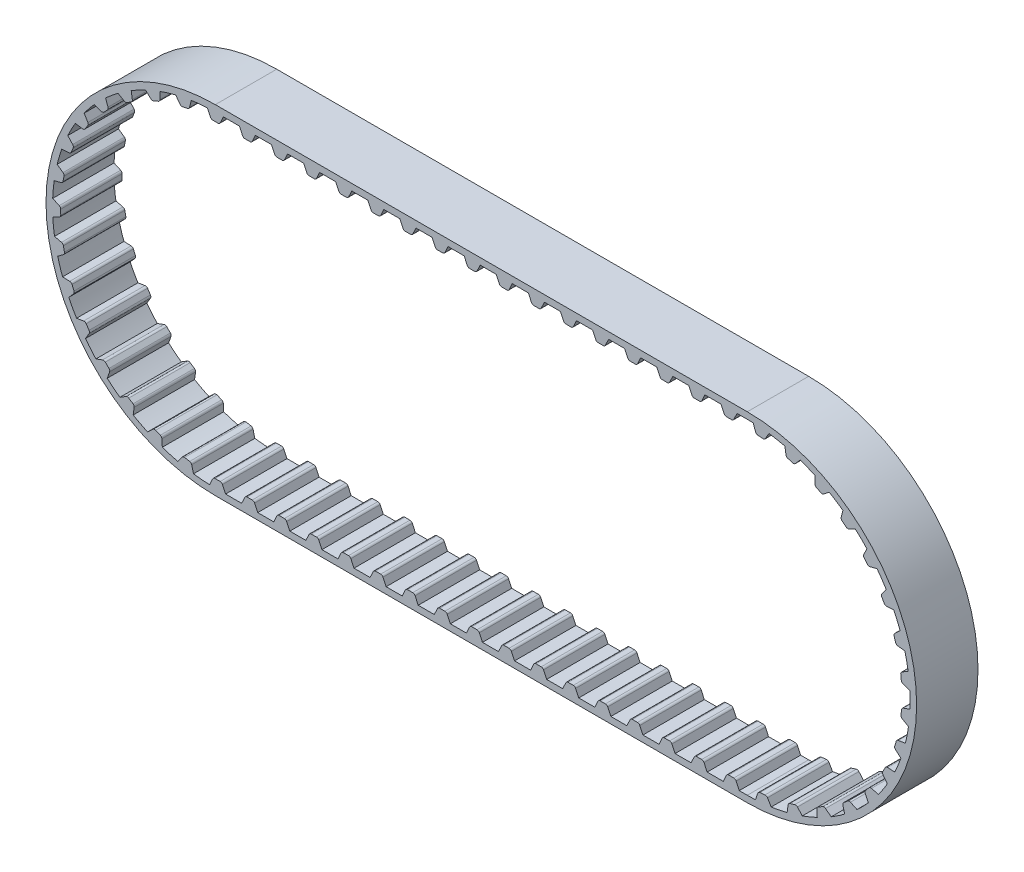
from build123d import *

# Parameters (mm, degrees)
BOSS_EXTRUDE1_DEPTH      = 4.7625
BOSS_EXTRUDE1_DEPTH_BACK = 4.7625
BOSS_EXTRUDE2_DEPTH      = 4.7625
FILLET1_R                = 0.396875
CRVPATTERN1_START        = -4.7625
CRVPATTERN1_DEPTH        = 9.525


# Read off the part's stored shape, not the designer's step: CrvPattern1
with BuildPart() as part:
    # Sketch4 → Boss-Extrude1 (new, two sides: drawn at the far end of the back side and taken through both)
    with BuildSketch(Plane.XY.offset(-BOSS_EXTRUDE1_DEPTH_BACK)):
        with BuildLine():
            Line((-41.275, -26.276481104), (41.275, -26.276481104))
            ThreePointArc((41.275, -26.276481104), (67.551481104, 0), (41.275, 26.276481104))
            Line((41.275, 26.276481104), (-41.275, 26.276481104))
            ThreePointArc((-41.275, 26.276481104), (-67.551481104, 0), (-41.275, -26.276481104))
        make_face()
        with BuildLine():
            Line((-41.275, -25.260481104), (41.275, -25.260481104))
            ThreePointArc((41.275, -25.260481104), (66.535481104, 0), (41.275, 25.260481104))
            Line((41.275, 25.260481104), (-41.275, 25.260481104))
            ThreePointArc((-41.275, 25.260481104), (-66.535481104, 0), (-41.275, -25.260481104))
        make_face(mode=Mode.SUBTRACT)
    extrude(amount=BOSS_EXTRUDE1_DEPTH + BOSS_EXTRUDE1_DEPTH_BACK)

    # Sketch5 → Boss-Extrude2 (add, symmetric)
    with BuildSketch(Plane.XY):
        Polygon((-42.5196, 25.260481104), (-41.927389274, 23.990481104), (-40.622610726, 23.990481104), (-40.0304, 25.260481104), align=None)
    extrude(amount=BOSS_EXTRUDE2_DEPTH, both=True)

    # Fillet1
    fillet1_edges = [part.edges().sort_by_distance(p)[0] for p in [
        (-41.927389274, 23.990481104, 0),
        (-40.622610726, 23.990481104, 0),
    ]]
    fillet(fillet1_edges, radius=FILLET1_R)

    # CrvPattern1 outline → CrvPattern1 (add)
    with BuildSketch(Plane.XY.offset(CRVPATTERN1_START)):
        with BuildLine():
            Line((-35.533968102, 24.219629482), (-35.04861102, 25.260481104))
            Line((-35.04861102, 25.260481104), (-37.53781102, 25.260481104))
            Line((-37.53781102, 25.260481104), (-37.052453937, 24.219629482))
            ThreePointArc((-37.052453937, 24.219629482), (-36.906003816, 24.052635124), (-36.692763034, 23.990481104))
            Line((-36.692763034, 23.990481104), (-35.893659005, 23.990481104))
            ThreePointArc((-35.893659005, 23.990481104), (-35.680418223, 24.052635124), (-35.533968102, 24.219629482))
        make_face()
        with BuildLine():
            Line((-30.552179122, 24.219629482), (-30.066822039, 25.260481104))
            Line((-30.066822039, 25.260481104), (-32.556022039, 25.260481104))
            Line((-32.556022039, 25.260481104), (-32.070664957, 24.219629482))
            ThreePointArc((-32.070664957, 24.219629482), (-31.924214836, 24.052635124), (-31.710974054, 23.990481104))
            Line((-31.710974054, 23.990481104), (-30.911870025, 23.990481104))
            ThreePointArc((-30.911870025, 23.990481104), (-30.698629243, 24.052635124), (-30.552179122, 24.219629482))
        make_face()
        with BuildLine():
            Line((-25.570390141, 24.219629482), (-25.085033059, 25.260481104))
            Line((-25.085033059, 25.260481104), (-27.574233059, 25.260481104))
            Line((-27.574233059, 25.260481104), (-27.088875976, 24.219629482))
            ThreePointArc((-27.088875976, 24.219629482), (-26.942425855, 24.052635124), (-26.729185073, 23.990481104))
            Line((-26.729185073, 23.990481104), (-25.930081044, 23.990481104))
            ThreePointArc((-25.930081044, 23.990481104), (-25.716840262, 24.052635124), (-25.570390141, 24.219629482))
        make_face()
        with BuildLine():
            Line((-20.588601161, 24.219629482), (-20.103244078, 25.260481104))
            Line((-20.103244078, 25.260481104), (-22.592444078, 25.260481104))
            Line((-22.592444078, 25.260481104), (-22.107086996, 24.219629482))
            ThreePointArc((-22.107086996, 24.219629482), (-21.960636875, 24.052635124), (-21.747396093, 23.990481104))
            Line((-21.747396093, 23.990481104), (-20.948292064, 23.990481104))
            ThreePointArc((-20.948292064, 23.990481104), (-20.735051282, 24.052635124), (-20.588601161, 24.219629482))
        make_face()
        with BuildLine():
            Line((-15.60681218, 24.219629482), (-15.121455098, 25.260481104))
            Line((-15.121455098, 25.260481104), (-17.610655098, 25.260481104))
            Line((-17.610655098, 25.260481104), (-17.125298015, 24.219629482))
            ThreePointArc((-17.125298015, 24.219629482), (-16.978847894, 24.052635124), (-16.765607112, 23.990481104))
            Line((-16.765607112, 23.990481104), (-15.966503083, 23.990481104))
            ThreePointArc((-15.966503083, 23.990481104), (-15.753262301, 24.052635124), (-15.60681218, 24.219629482))
        make_face()
        with BuildLine():
            Line((-10.6250232, 24.219629482), (-10.139666117, 25.260481104))
            Line((-10.139666117, 25.260481104), (-12.628866117, 25.260481104))
            Line((-12.628866117, 25.260481104), (-12.143509035, 24.219629482))
            ThreePointArc((-12.143509035, 24.219629482), (-11.997058914, 24.052635124), (-11.783818132, 23.990481104))
            Line((-11.783818132, 23.990481104), (-10.984714103, 23.990481104))
            ThreePointArc((-10.984714103, 23.990481104), (-10.771473321, 24.052635124), (-10.6250232, 24.219629482))
        make_face()
        with BuildLine():
            Line((-5.64323422, 24.219629482), (-5.157877137, 25.260481104))
            Line((-5.157877137, 25.260481104), (-7.647077137, 25.260481104))
            Line((-7.647077137, 25.260481104), (-7.161720054, 24.219629482))
            ThreePointArc((-7.161720054, 24.219629482), (-7.015269933, 24.052635124), (-6.802029151, 23.990481104))
            Line((-6.802029151, 23.990481104), (-6.002925123, 23.990481104))
            ThreePointArc((-6.002925123, 23.990481104), (-5.789684341, 24.052635124), (-5.64323422, 24.219629482))
        make_face()
        with BuildLine():
            Line((-0.661445239, 24.219629482), (-0.176088157, 25.260481104))
            Line((-0.176088157, 25.260481104), (-2.665288157, 25.260481104))
            Line((-2.665288157, 25.260481104), (-2.179931074, 24.219629482))
            ThreePointArc((-2.179931074, 24.219629482), (-2.033480953, 24.052635124), (-1.820240171, 23.990481104))
            Line((-1.820240171, 23.990481104), (-1.021136142, 23.990481104))
            ThreePointArc((-1.021136142, 23.990481104), (-0.80789536, 24.052635124), (-0.661445239, 24.219629482))
        make_face()
        with BuildLine():
            Line((4.320343741, 24.219629482), (4.805700824, 25.260481104))
            Line((4.805700824, 25.260481104), (2.316500824, 25.260481104))
            Line((2.316500824, 25.260481104), (2.801857906, 24.219629482))
            ThreePointArc((2.801857906, 24.219629482), (2.948308027, 24.052635124), (3.161548809, 23.990481104))
            Line((3.161548809, 23.990481104), (3.960652838, 23.990481104))
            ThreePointArc((3.960652838, 23.990481104), (4.17389362, 24.052635124), (4.320343741, 24.219629482))
        make_face()
        with BuildLine():
            Line((9.302132722, 24.219629482), (9.787489804, 25.260481104))
            Line((9.787489804, 25.260481104), (7.298289804, 25.260481104))
            Line((7.298289804, 25.260481104), (7.783646887, 24.219629482))
            ThreePointArc((7.783646887, 24.219629482), (7.930097008, 24.052635124), (8.14333779, 23.990481104))
            Line((8.14333779, 23.990481104), (8.942441819, 23.990481104))
            ThreePointArc((8.942441819, 23.990481104), (9.155682601, 24.052635124), (9.302132722, 24.219629482))
        make_face()
        with BuildLine():
            Line((14.283921702, 24.219629482), (14.769278785, 25.260481104))
            Line((14.769278785, 25.260481104), (12.280078785, 25.260481104))
            Line((12.280078785, 25.260481104), (12.765435867, 24.219629482))
            ThreePointArc((12.765435867, 24.219629482), (12.911885988, 24.052635124), (13.12512677, 23.990481104))
            Line((13.12512677, 23.990481104), (13.924230799, 23.990481104))
            ThreePointArc((13.924230799, 23.990481104), (14.137471581, 24.052635124), (14.283921702, 24.219629482))
        make_face()
        with BuildLine():
            Line((19.265710683, 24.219629482), (19.751067765, 25.260481104))
            Line((19.751067765, 25.260481104), (17.261867765, 25.260481104))
            Line((17.261867765, 25.260481104), (17.747224848, 24.219629482))
            ThreePointArc((17.747224848, 24.219629482), (17.893674969, 24.052635124), (18.106915751, 23.990481104))
            Line((18.106915751, 23.990481104), (18.90601978, 23.990481104))
            ThreePointArc((18.90601978, 23.990481104), (19.119260562, 24.052635124), (19.265710683, 24.219629482))
        make_face()
        with BuildLine():
            Line((24.247499663, 24.219629482), (24.732856746, 25.260481104))
            Line((24.732856746, 25.260481104), (22.243656746, 25.260481104))
            Line((22.243656746, 25.260481104), (22.729013828, 24.219629482))
            ThreePointArc((22.729013828, 24.219629482), (22.875463949, 24.052635124), (23.088704731, 23.990481104))
            Line((23.088704731, 23.990481104), (23.88780876, 23.990481104))
            ThreePointArc((23.88780876, 23.990481104), (24.101049542, 24.052635124), (24.247499663, 24.219629482))
        make_face()
        with BuildLine():
            Line((29.229288643, 24.219629482), (29.714645726, 25.260481104))
            Line((29.714645726, 25.260481104), (27.225445726, 25.260481104))
            Line((27.225445726, 25.260481104), (27.710802809, 24.219629482))
            ThreePointArc((27.710802809, 24.219629482), (27.85725293, 24.052635124), (28.070493712, 23.990481104))
            Line((28.070493712, 23.990481104), (28.86959774, 23.990481104))
            ThreePointArc((28.86959774, 23.990481104), (29.082838522, 24.052635124), (29.229288643, 24.219629482))
        make_face()
        with BuildLine():
            Line((34.211077624, 24.219629482), (34.696434706, 25.260481104))
            Line((34.696434706, 25.260481104), (32.207234706, 25.260481104))
            Line((32.207234706, 25.260481104), (32.692591789, 24.219629482))
            ThreePointArc((32.692591789, 24.219629482), (32.83904191, 24.052635124), (33.052282692, 23.990481104))
            Line((33.052282692, 23.990481104), (33.851386721, 23.990481104))
            ThreePointArc((33.851386721, 23.990481104), (34.064627503, 24.052635124), (34.211077624, 24.219629482))
        make_face()
        with BuildLine():
            ThreePointArc((-45.011921592, 24.982540356), (-46.224557751, 24.770825252), (-47.42543994, 24.500285594))
            Line((-47.42543994, 24.500285594), (-46.765138049, 23.601383143))
            ThreePointArc((-46.765138049, 23.601383143), (-46.588805756, 23.466321395), (-46.367519984, 23.447154745))
            Line((-46.367519984, 23.447154745), (-45.583905999, 23.603731792))
            ThreePointArc((-45.583905999, 23.603731792), (-45.386977238, 23.706463562), (-45.276086946, 23.898916404))
            Line((-45.276086946, 23.898916404), (-45.011921592, 24.982540356))
        make_face()
        with BuildLine():
            ThreePointArc((-49.834581945, 23.766056942), (-50.982228426, 23.320840935), (-52.106822652, 22.820243725))
            Line((-52.106822652, 22.820243725), (-51.283188603, 22.068145888))
            ThreePointArc((-51.283188603, 22.068145888), (-51.08381028, 21.970252896), (-50.863058442, 21.994816679))
            Line((-50.863058442, 21.994816679), (-50.125314063, 22.301900511))
            ThreePointArc((-50.125314063, 22.301900511), (-49.952331962, 22.441227271), (-49.881300552, 22.651677484))
            Line((-49.881300552, 22.651677484), (-49.834581945, 23.766056942))
        make_face()
        with BuildLine():
            ThreePointArc((-54.325399894, 21.628198451), (-55.363564132, 20.96674191), (-56.36827153, 20.255494567))
            Line((-56.36827153, 20.255494567), (-55.413236403, 19.679359072))
            ThreePointArc((-55.413236403, 19.679359072), (-55.198541656, 19.622430003), (-54.986881976, 19.689771916))
            Line((-54.986881976, 19.689771916), (-54.323608467, 20.135457345))
            ThreePointArc((-54.323608467, 20.135457345), (-54.181279288, 20.305977602), (-54.152860543, 20.526266341))
            Line((-54.152860543, 20.526266341), (-54.325399894, 21.628198451))
        make_face()
        with BuildLine():
            ThreePointArc((-58.310273032, 18.651846513), (-59.198706925, 17.799793136), (-60.044576466, 16.905469674))
            Line((-60.044576466, 16.905469674), (-58.995165569, 16.527632445))
            ThreePointArc((-58.995165569, 16.527632445), (-58.773477797, 16.513874355), (-58.57911601, 16.621383653))
            Line((-58.57911601, 16.621383653), (-58.016027511, 17.18839211))
            ThreePointArc((-58.016027511, 17.18839211), (-57.909869146, 17.383495044), (-57.925164819, 17.605082038))
            Line((-57.925164819, 17.605082038), (-58.310273032, 18.651846513))
        make_face()
        with BuildLine():
            ThreePointArc((-61.634713687, 14.952389916), (-62.33897396, 13.942772559), (-62.993212528, 12.900044582))
            Line((-62.993212528, 12.900044582), (-61.890109977, 12.735153815))
            ThreePointArc((-61.890109977, 12.735153815), (-61.670023689, 12.765100085), (-61.500494915, 12.908608789))
            Line((-61.500494915, 12.908608789), (-61.059421537, 13.57495819))
            ThreePointArc((-61.059421537, 13.57495819), (-60.99354959, 13.787079948), (-61.051966691, 14.001374595))
            Line((-61.051966691, 14.001374595), (-61.634713687, 14.952389916))
        make_face()
        with BuildLine():
            ThreePointArc((-64.169838184, 10.673251152), (-64.662621701, 9.545211195), (-65.099865428, 8.394503734))
            Line((-65.099865428, 8.394503734), (-63.985836888, 8.448952))
            ThreePointArc((-63.985836888, 8.448952), (-63.775884505, 8.521441657), (-63.637761126, 8.695386147))
            Line((-63.637761126, 8.695386147), (-63.335802637, 9.435243106))
            ThreePointArc((-63.335802637, 9.435243106), (-63.312770866, 9.656160038), (-63.41204465, 9.85485445))
            Line((-63.41204465, 9.85485445), (-64.169838184, 10.673251152))
        make_face()
        with BuildLine():
            ThreePointArc((-65.817363474, 5.980326137), (-66.079565745, 4.777596031), (-66.282863334, 3.563520321))
            Line((-66.282863334, 3.563520321), (-65.201098052, 3.835196742))
            ThreePointArc((-65.201098052, 3.835196742), (-65.00941912, 3.947419468), (-64.908055976, 4.145056171))
            Line((-64.908055976, 4.145056171), (-64.756918861, 4.929737522))
            ThreePointArc((-64.756918861, 4.929737522), (-64.777620176, 5.150885004), (-64.913901943, 5.326276091))
            Line((-64.913901943, 5.326276091), (-65.817363474, 5.980326137))
        make_face()
        with BuildLine():
            ThreePointArc((-66.513417426, 1.055552672), (-66.534873252, -0.175239506), (-66.496343156, -1.405615534))
            Line((-66.496343156, -1.405615534), (-65.488779581, -0.927243455))
            ThreePointArc((-65.488779581, -0.927243455), (-65.322805211, -0.779638368), (-65.262132001, -0.565971536))
            Line((-65.262132001, -0.565971536), (-65.267675625, 0.233113264))
            ThreePointArc((-65.267675625, 0.233113264), (-65.331307464, 0.445917733), (-65.499313771, 0.59120584))
            Line((-65.499313771, 0.59120584), (-66.513417426, 1.055552672))
        make_face()
        with BuildLine():
            ThreePointArc((-66.23101505, -3.910143017), (-66.010892622, -5.121281265), (-65.732028595, -6.320257742))
            Line((-65.732028595, -6.320257742), (-64.837728486, -5.653735785))
            ThreePointArc((-64.837728486, -5.653735785), (-64.703893259, -5.476470771), (-64.686262195, -5.25505736))
            Line((-64.686262195, -5.25505736), (-64.848271639, -4.472548453))
            ThreePointArc((-64.848271639, -4.472548453), (-64.952367091, -4.276337112), (-65.145584581, -4.166784591))
            Line((-65.145584581, -4.166784591), (-66.23101505, -3.910143017))
        make_face()
        with BuildLine():
            ThreePointArc((-64.981104673, -8.724248212), (-64.527937813, -9.86877848), (-64.019551003, -10.989872852))
            Line((-64.019551003, -10.989872852), (-63.27318506, -10.161041095))
            ThreePointArc((-63.27318506, -10.161041095), (-63.17667757, -9.960988457), (-63.202772184, -9.740412337))
            Line((-63.202772184, -9.740412337), (-63.51496658, -9.004816043))
            ThreePointArc((-63.51496658, -9.004816043), (-63.655490016, -8.832804656), (-63.86642793, -8.763234911))
            Line((-63.86642793, -8.763234911), (-64.981104673, -8.724248212))
        make_face()
        with BuildLine():
            ThreePointArc((-62.81214348, -13.200127134), (-62.1435008, -14.233677668), (-61.425300617, -15.233426754))
            Line((-61.425300617, -15.233426754), (-60.85580435, -14.274417784))
            ThreePointArc((-60.85580435, -14.274417784), (-60.800366052, -14.059333269), (-60.869174692, -13.848145854))
            Line((-60.869174692, -13.848145854), (-61.319450723, -13.187980159))
            ThreePointArc((-61.319450723, -13.187980159), (-61.490954256, -13.046837354), (-61.711434843, -13.019947502))
            Line((-61.711434843, -13.019947502), (-62.81214348, -13.200127134))
        make_face()
        with BuildLine():
            ThreePointArc((-59.808218908, -17.164256539), (-58.950022703, -18.046758104), (-58.04985271, -18.886403102))
            Line((-58.04985271, -18.886403102), (-57.679304651, -17.834396288))
            ThreePointArc((-57.679304651, -17.834396288), (-57.667084807, -17.612618407), (-57.775939863, -17.419007121))
            Line((-57.775939863, -17.419007121), (-58.346840989, -16.859865678))
            ThreePointArc((-58.346840989, -16.859865678), (-58.542675681, -16.755063355), (-58.764151232, -16.771895875))
            Line((-58.764151232, -16.771895875), (-59.808218908, -17.164256539))
        make_face()
        with BuildLine():
            ThreePointArc((-56.085788694, -20.462952961), (-55.071309968, -21.160192269), (-54.024068434, -21.807181379))
            Line((-54.024068434, -21.807181379), (-53.866834186, -20.702961476))
            ThreePointArc((-53.866834186, -20.702961476), (-53.89830654, -20.48308823), (-54.042987863, -20.314559098))
            Line((-54.042987863, -20.314559098), (-54.712381087, -19.878118999))
            ThreePointArc((-54.712381087, -19.878118999), (-54.924954714, -19.81372019), (-55.138838947, -19.873622511))
            Line((-55.138838947, -19.873622511), (-56.085788694, -20.462952961))
        make_face()
        with BuildLine():
            ThreePointArc((-51.789165984, -22.96833079), (-50.657734585, -23.453276899), (-49.504021523, -23.882527303))
            Line((-49.504021523, -23.882527303), (-49.566196828, -22.768903294))
            ThreePointArc((-49.566196828, -22.768903294), (-49.640141243, -22.559458846), (-49.81503975, -22.422545495))
            Line((-49.81503975, -22.422545495), (-50.556973682, -22.125726881))
            ThreePointArc((-50.556973682, -22.125726881), (-50.778045076, -22.104228232), (-50.976046015, -22.204878028))
            Line((-50.976046015, -22.204878028), (-51.789165984, -22.96833079))
        make_face()
        with BuildLine():
            ThreePointArc((-47.084924521, -24.583260212), (-45.880404381, -24.837112475), (-44.66494755, -25.031982766))
            Line((-44.66494755, -25.031982766), (-44.944121962, -23.952128216))
            ThreePointArc((-44.944121962, -23.952128216), (-45.057671723, -23.761232419), (-45.256006856, -23.661242779))
            Line((-45.256006856, -23.661242779), (-46.041717807, -23.51555287))
            ThreePointArc((-46.041717807, -23.51555287), (-46.262716357, -23.537787852), (-46.437157796, -23.67528308))
            Line((-46.437157796, -23.67528308), (-47.084924521, -24.583260212))
        make_face()
        with BuildLine():
            Line((-41.275, -25.260481104), (-39.679918177, -25.260481104))
            Line((-39.679918177, -25.260481104), (-40.16527526, -24.219629482))
            ThreePointArc((-40.16527526, -24.219629482), (-40.311725381, -24.052635124), (-40.524966163, -23.990481104))
            Line((-40.524966163, -23.990481104), (-41.324070191, -23.990481104))
            ThreePointArc((-41.324070191, -23.990481104), (-41.537310974, -24.052635124), (-41.683761094, -24.219629482))
            Line((-41.683761094, -24.219629482), (-42.161856424, -25.244908225))
            ThreePointArc((-42.161856424, -25.244908225), (-41.71849657, -25.256587584), (-41.275, -25.260481104))
        make_face()
        with BuildLine():
            Line((-37.187329197, -25.260481104), (-34.698129197, -25.260481104))
            Line((-34.698129197, -25.260481104), (-35.183486279, -24.219629482))
            ThreePointArc((-35.183486279, -24.219629482), (-35.3299364, -24.052635124), (-35.543177182, -23.990481104))
            Line((-35.543177182, -23.990481104), (-36.342281211, -23.990481104))
            ThreePointArc((-36.342281211, -23.990481104), (-36.555521993, -24.052635124), (-36.701972114, -24.219629482))
            Line((-36.701972114, -24.219629482), (-37.187329197, -25.260481104))
        make_face()
        with BuildLine():
            Line((-32.205540216, -25.260481104), (-29.716340216, -25.260481104))
            Line((-29.716340216, -25.260481104), (-30.201697299, -24.219629482))
            ThreePointArc((-30.201697299, -24.219629482), (-30.34814742, -24.052635124), (-30.561388202, -23.990481104))
            Line((-30.561388202, -23.990481104), (-31.360492231, -23.990481104))
            ThreePointArc((-31.360492231, -23.990481104), (-31.573733013, -24.052635124), (-31.720183134, -24.219629482))
            Line((-31.720183134, -24.219629482), (-32.205540216, -25.260481104))
        make_face()
        with BuildLine():
            Line((-27.223751236, -25.260481104), (-24.734551236, -25.260481104))
            Line((-24.734551236, -25.260481104), (-25.219908318, -24.219629482))
            ThreePointArc((-25.219908318, -24.219629482), (-25.366358439, -24.052635124), (-25.579599221, -23.990481104))
            Line((-25.579599221, -23.990481104), (-26.37870325, -23.990481104))
            ThreePointArc((-26.37870325, -23.990481104), (-26.591944032, -24.052635124), (-26.738394153, -24.219629482))
            Line((-26.738394153, -24.219629482), (-27.223751236, -25.260481104))
        make_face()
        with BuildLine():
            Line((-22.241962255, -25.260481104), (-19.752762255, -25.260481104))
            Line((-19.752762255, -25.260481104), (-20.238119338, -24.219629482))
            ThreePointArc((-20.238119338, -24.219629482), (-20.384569459, -24.052635124), (-20.597810241, -23.990481104))
            Line((-20.597810241, -23.990481104), (-21.39691427, -23.990481104))
            ThreePointArc((-21.39691427, -23.990481104), (-21.610155052, -24.052635124), (-21.756605173, -24.219629482))
            Line((-21.756605173, -24.219629482), (-22.241962255, -25.260481104))
        make_face()
        with BuildLine():
            Line((-17.260173275, -25.260481104), (-14.770973275, -25.260481104))
            Line((-14.770973275, -25.260481104), (-15.256330358, -24.219629482))
            ThreePointArc((-15.256330358, -24.219629482), (-15.402780478, -24.052635124), (-15.616021261, -23.990481104))
            Line((-15.616021261, -23.990481104), (-16.415125289, -23.990481104))
            ThreePointArc((-16.415125289, -23.990481104), (-16.628366071, -24.052635124), (-16.774816192, -24.219629482))
            Line((-16.774816192, -24.219629482), (-17.260173275, -25.260481104))
        make_face()
        with BuildLine():
            Line((-12.278384295, -25.260481104), (-9.789184295, -25.260481104))
            Line((-9.789184295, -25.260481104), (-10.274541377, -24.219629482))
            ThreePointArc((-10.274541377, -24.219629482), (-10.420991498, -24.052635124), (-10.63423228, -23.990481104))
            Line((-10.63423228, -23.990481104), (-11.433336309, -23.990481104))
            ThreePointArc((-11.433336309, -23.990481104), (-11.646577091, -24.052635124), (-11.793027212, -24.219629482))
            Line((-11.793027212, -24.219629482), (-12.278384295, -25.260481104))
        make_face()
        with BuildLine():
            Line((-7.296595314, -25.260481104), (-4.807395314, -25.260481104))
            Line((-4.807395314, -25.260481104), (-5.292752397, -24.219629482))
            ThreePointArc((-5.292752397, -24.219629482), (-5.439202518, -24.052635124), (-5.6524433, -23.990481104))
            Line((-5.6524433, -23.990481104), (-6.451547328, -23.990481104))
            ThreePointArc((-6.451547328, -23.990481104), (-6.664788111, -24.052635124), (-6.811238231, -24.219629482))
            Line((-6.811238231, -24.219629482), (-7.296595314, -25.260481104))
        make_face()
        with BuildLine():
            Line((-2.314806334, -25.260481104), (0.174393666, -25.260481104))
            Line((0.174393666, -25.260481104), (-0.310963416, -24.219629482))
            ThreePointArc((-0.310963416, -24.219629482), (-0.457413537, -24.052635124), (-0.670654319, -23.990481104))
            Line((-0.670654319, -23.990481104), (-1.469758348, -23.990481104))
            ThreePointArc((-1.469758348, -23.990481104), (-1.68299913, -24.052635124), (-1.829449251, -24.219629482))
            Line((-1.829449251, -24.219629482), (-2.314806334, -25.260481104))
        make_face()
        with BuildLine():
            Line((2.666982647, -25.260481104), (5.156182647, -25.260481104))
            Line((5.156182647, -25.260481104), (4.670825564, -24.219629482))
            ThreePointArc((4.670825564, -24.219629482), (4.524375443, -24.052635124), (4.311134661, -23.990481104))
            Line((4.311134661, -23.990481104), (3.512030632, -23.990481104))
            ThreePointArc((3.512030632, -23.990481104), (3.29878985, -24.052635124), (3.152339729, -24.219629482))
            Line((3.152339729, -24.219629482), (2.666982647, -25.260481104))
        make_face()
        with BuildLine():
            Line((7.648771627, -25.260481104), (10.137971627, -25.260481104))
            Line((10.137971627, -25.260481104), (9.652614545, -24.219629482))
            ThreePointArc((9.652614545, -24.219629482), (9.506164424, -24.052635124), (9.292923642, -23.990481104))
            Line((9.292923642, -23.990481104), (8.493819613, -23.990481104))
            ThreePointArc((8.493819613, -23.990481104), (8.280578831, -24.052635124), (8.13412871, -24.219629482))
            Line((8.13412871, -24.219629482), (7.648771627, -25.260481104))
        make_face()
        with BuildLine():
            Line((12.630560608, -25.260481104), (15.119760608, -25.260481104))
            Line((15.119760608, -25.260481104), (14.634403525, -24.219629482))
            ThreePointArc((14.634403525, -24.219629482), (14.487953404, -24.052635124), (14.274712622, -23.990481104))
            Line((14.274712622, -23.990481104), (13.475608593, -23.990481104))
            ThreePointArc((13.475608593, -23.990481104), (13.262367811, -24.052635124), (13.11591769, -24.219629482))
            Line((13.11591769, -24.219629482), (12.630560608, -25.260481104))
        make_face()
        with BuildLine():
            Line((17.612349588, -25.260481104), (20.101549588, -25.260481104))
            Line((20.101549588, -25.260481104), (19.616192505, -24.219629482))
            ThreePointArc((19.616192505, -24.219629482), (19.469742385, -24.052635124), (19.256501602, -23.990481104))
            Line((19.256501602, -23.990481104), (18.457397574, -23.990481104))
            ThreePointArc((18.457397574, -23.990481104), (18.244156792, -24.052635124), (18.097706671, -24.219629482))
            Line((18.097706671, -24.219629482), (17.612349588, -25.260481104))
        make_face()
        with BuildLine():
            Line((22.594138568, -25.260481104), (25.083338568, -25.260481104))
            Line((25.083338568, -25.260481104), (24.597981486, -24.219629482))
            ThreePointArc((24.597981486, -24.219629482), (24.451531365, -24.052635124), (24.238290583, -23.990481104))
            Line((24.238290583, -23.990481104), (23.439186554, -23.990481104))
            ThreePointArc((23.439186554, -23.990481104), (23.225945772, -24.052635124), (23.079495651, -24.219629482))
            Line((23.079495651, -24.219629482), (22.594138568, -25.260481104))
        make_face()
        with BuildLine():
            Line((27.575927549, -25.260481104), (30.065127549, -25.260481104))
            Line((30.065127549, -25.260481104), (29.579770466, -24.219629482))
            ThreePointArc((29.579770466, -24.219629482), (29.433320345, -24.052635124), (29.220079563, -23.990481104))
            Line((29.220079563, -23.990481104), (28.420975535, -23.990481104))
            ThreePointArc((28.420975535, -23.990481104), (28.207734752, -24.052635124), (28.061284632, -24.219629482))
            Line((28.061284632, -24.219629482), (27.575927549, -25.260481104))
        make_face()
        with BuildLine():
            Line((32.557716529, -25.260481104), (35.046916529, -25.260481104))
            Line((35.046916529, -25.260481104), (34.561559447, -24.219629482))
            ThreePointArc((34.561559447, -24.219629482), (34.415109326, -24.052635124), (34.201868544, -23.990481104))
            Line((34.201868544, -23.990481104), (33.402764515, -23.990481104))
            ThreePointArc((33.402764515, -23.990481104), (33.189523733, -24.052635124), (33.043073612, -24.219629482))
            Line((33.043073612, -24.219629482), (32.557716529, -25.260481104))
        make_face()
        with BuildLine():
            Line((37.53950551, -25.260481104), (40.02870551, -25.260481104))
            Line((40.02870551, -25.260481104), (39.543348427, -24.219629482))
            ThreePointArc((39.543348427, -24.219629482), (39.396898306, -24.052635124), (39.183657524, -23.990481104))
            Line((39.183657524, -23.990481104), (38.384553495, -23.990481104))
            ThreePointArc((38.384553495, -23.990481104), (38.171312713, -24.052635124), (38.024862592, -24.219629482))
            Line((38.024862592, -24.219629482), (37.53950551, -25.260481104))
        make_face()
        with BuildLine():
            ThreePointArc((42.534271309, -25.229073336), (43.761859705, -25.137769082), (44.983542428, -24.986768872))
            Line((44.983542428, -24.986768872), (44.414943909, -24.027227353))
            ThreePointArc((44.414943909, -24.027227353), (44.252764857, -23.875462046), (44.034440992, -23.834603224))
            Line((44.034440992, -23.834603224), (43.239218904, -23.913273919))
            ThreePointArc((43.239218904, -23.913273919), (43.033132995, -23.996119266), (42.903834674, -24.1767202))
            Line((42.903834674, -24.1767202), (42.534271309, -25.229073336))
        make_face()
        with BuildLine():
            ThreePointArc((47.453264949, -24.493283729), (48.639167223, -24.163214743), (49.807581429, -23.775764126))
            Line((49.807581429, -23.775764126), (49.061991484, -22.946234237))
            ThreePointArc((49.061991484, -22.946234237), (48.873219145, -22.829188274), (48.651121419, -22.831900014))
            Line((48.651121419, -22.831900014), (47.886728922, -23.064862152))
            ThreePointArc((47.886728922, -23.064862152), (47.700870616, -23.186482231), (47.609465732, -23.38891716))
            Line((47.609465732, -23.38891716), (47.453264949, -24.493283729))
        make_face()
        with BuildLine():
            ThreePointArc((52.132736344, -22.807925532), (53.230976807, -22.251888104), (54.300824797, -21.64300797))
            Line((54.300824797, -21.64300797), (53.407148851, -20.975649365))
            ThreePointArc((53.407148851, -20.975649365), (53.199101651, -20.897860447), (52.981840467, -20.944037618))
            Line((52.981840467, -20.944037618), (52.277911933, -21.3222596))
            ThreePointArc((52.277911933, -21.3222596), (52.119486684, -21.47793938), (52.069518869, -21.694360199))
            Line((52.069518869, -21.694360199), (52.132736344, -22.807925532))
        make_face()
        with BuildLine():
            ThreePointArc((56.391269268, -20.238337605), (57.359270754, -19.477888487), (58.289076093, -18.671184224))
            Line((58.289076093, -18.671184224), (57.281960649, -18.191869415))
            ThreePointArc((57.281960649, -18.191869415), (57.062704271, -18.156353303), (56.858702525, -18.244205684))
            Line((56.858702525, -18.244205684), (56.242528229, -18.7530244))
            ThreePointArc((56.242528229, -18.7530244), (56.117677951, -18.936728405), (56.111084385, -19.158744796))
            Line((56.111084385, -19.158744796), (56.391269268, -20.238337605))
        make_face()
        with BuildLine():
            ThreePointArc((60.063766663, -16.884139093), (60.864001177, -15.948759779), (61.617716681, -14.975506124))
            Line((61.617716681, -14.975506124), (60.536206124, -14.702817441))
            ThreePointArc((60.536206124, -14.702817441), (60.314240816, -14.710951043), (60.131407355, -14.837072726))
            Line((60.131407355, -14.837072726), (59.626875468, -15.456762023))
            ThreePointArc((59.626875468, -15.456762023), (59.540440423, -15.661368319), (59.577476727, -15.880373034))
            Line((59.577476727, -15.880373034), (60.063766663, -16.884139093))
        make_face()
        with BuildLine():
            ThreePointArc((63.007851206, -12.875367338), (63.609294833, -11.801321109), (64.157700059, -10.699249675))
            Line((64.157700059, -10.699249675), (63.043722963, -10.643758858))
            ThreePointArc((63.043722963, -10.643758858), (62.827653994, -10.695226846), (62.673077003, -10.854728279))
            Line((62.673077003, -10.854728279), (62.299747484, -11.561263713))
            ThreePointArc((62.299747484, -11.561263713), (62.255078631, -11.778840014), (62.334308963, -11.986342563))
            Line((62.334308963, -11.986342563), (63.007851206, -12.875367338))
        make_face()
        with BuildLine():
            ThreePointArc((65.109385068, -8.367436527), (65.488720724, -7.196362575), (65.810554809, -6.008199051))
            Line((65.810554809, -6.008199051), (64.707298426, -6.172057396))
            ThreePointArc((64.707298426, -6.172057396), (64.505502472, -6.264864432), (64.385174674, -6.45156198))
            Line((64.385174674, -6.45156198), (64.15752096, -7.217552212))
            ThreePointArc((64.15752096, -7.217552212), (64.156350044, -7.439663406), (64.274702761, -7.627619219))
            Line((64.274702761, -7.627619219), (65.109385068, -8.367436527))
        make_face()
        with BuildLine():
            ThreePointArc((66.286894874, -3.535112506), (66.429416272, -2.312411648), (66.512202181, -1.084219386))
            Line((66.512202181, -1.084219386), (65.46243814, -1.461074346))
            ThreePointArc((65.46243814, -1.461074346), (65.282738533, -1.591622438), (65.201324859, -1.798278111))
            Line((65.201324859, -1.798278111), (65.12817275, -2.594026826))
            ThreePointArc((65.12817275, -2.594026826), (65.170545167, -2.812061987), (65.323431907, -2.973184295))
            Line((65.323431907, -2.973184295), (66.286894874, -3.535112506))
        make_face()
        with BuildLine():
            ThreePointArc((66.494730298, 1.434262627), (66.394912094, 2.661188079), (66.23544034, 3.881793871))
            Line((66.23544034, 3.881793871), (65.279866449, 3.306552407))
            ThreePointArc((65.279866449, 3.306552407), (65.129229877, 3.143324417), (65.089886617, 2.924722356))
            Line((65.089886617, 2.924722356), (65.174072112, 2.130065165))
            ThreePointArc((65.174072112, 2.130065165), (65.258345145, 1.924558938), (65.439838715, 1.796516611))
            Line((65.439838715, 1.796516611), (66.494730298, 1.434262627))
        make_face()
        with BuildLine():
            ThreePointArc((65.724833868, 6.348033508), (65.386545867, 7.531617457), (64.990998934, 8.697315687))
            Line((64.990998934, 8.697315687), (64.166661387, 7.945988987))
            ThreePointArc((64.166661387, 7.945988987), (64.050927811, 7.756409207), (64.055180243, 7.534335638))
            Line((64.055180243, 7.534335638), (64.293439595, 6.771577662))
            ThreePointArc((64.293439595, 6.771577662), (64.416346102, 6.586567544), (64.619410263, 6.496569211))
            Line((64.619410263, 6.496569211), (65.724833868, 6.348033508))
        make_face()
        with BuildLine():
            ThreePointArc((64.007053336, 11.015700465), (63.443410465, 12.110057104), (62.827123127, 13.175655366))
            Line((62.827123127, 13.175655366), (62.165980279, 12.277371259))
            ThreePointArc((62.165980279, 12.277371259), (62.089636518, 12.06878942), (62.137319783, 11.851853808))
            Line((62.137319783, 11.851853808), (62.520416027, 11.150566052))
            ThreePointArc((62.520416027, 11.150566052), (62.677191104, 10.993224613), (62.893953357, 10.944759376))
            Line((62.893953357, 10.944759376), (64.007053336, 11.015700465))
        make_face()
        with BuildLine():
            ThreePointArc((61.407984527, 15.256304915), (60.640838392, 16.219007645), (59.827703202, 17.143194261))
            Line((59.827703202, 17.143194261), (59.355386589, 16.132777903))
            ThreePointArc((59.355386589, 16.132777903), (59.321392378, 15.913280415), (59.410657866, 15.709893036))
            Line((59.410657866, 15.709893036), (59.923738923, 15.097263395))
            ThreePointArc((59.923738923, 15.097263395), (60.108304631, 14.97369053), (60.330361422, 14.968637317))
            Line((60.330361422, 14.968637317), (61.407984527, 15.256304915))
        make_face()
        with BuildLine():
            ThreePointArc((58.028389516, 18.90544486), (57.087481244, 19.699171112), (56.109022259, 20.446116728))
            Line((56.109022259, 20.446116728), (55.8438429, 19.362740473))
            ThreePointArc((55.8438429, 19.362740473), (55.853516146, 19.140836932), (55.980903164, 18.958882814))
            Line((55.980903164, 18.958882814), (56.604077637, 18.458662038))
            ThreePointArc((56.604077637, 18.458662038), (56.809278635, 18.373648487), (57.028021149, 18.412203201))
            Line((57.028021149, 18.412203201), (58.028389516, 18.90544486))
        make_face()
        with BuildLine():
            ThreePointArc((53.999290231, 21.821648511), (52.921097453, 22.415626686), (51.815248087, 22.956373317))
            Line((51.815248087, 22.956373317), (51.767486597, 21.84203807))
            ThreePointArc((51.767486597, 21.84203807), (51.820452282, 21.626331349), (51.981022224, 21.472864587))
            Line((51.981022224, 21.472864587), (52.690130555, 21.1044455))
            ThreePointArc((52.690130555, 21.1044455), (52.908011502, 21.061287113), (53.114959413, 21.141955046))
            Line((53.114959413, 21.141955046), (53.999290231, 21.821648511))
        make_face()
        with BuildLine():
            ThreePointArc((49.476888927, 23.891858941), (48.303211591, 24.263061378), (47.112843998, 24.576645073))
            Line((47.112843998, 24.576645073), (47.284352019, 23.474551973))
            ThreePointArc((47.284352019, 23.474551973), (47.378556741, 23.273404705), (47.566084546, 23.154374979))
            Line((47.566084546, 23.154374979), (48.333635648, 22.932040647))
            ThreePointArc((48.333635648, 22.932040647), (48.55574962, 22.932410611), (48.742879862, 23.052064385))
            Line((48.742879862, 23.052064385), (49.476888927, 23.891858941))
        make_face()
        with BuildLine():
            ThreePointArc((44.636512451, 25.035817136), (43.412852301, 25.169852863), (42.184115283, 25.244116443))
            Line((42.184115283, 25.244116443), (42.568243702, 24.196992019))
            ThreePointArc((42.568243702, 24.196992019), (42.700035282, 24.018202387), (42.907250773, 23.938224304))
            Line((42.907250773, 23.938224304), (43.703487818, 23.870594302))
            ThreePointArc((43.703487818, 23.870594302), (43.921223783, 23.914478274), (44.081281592, 24.068479089))
            Line((44.081281592, 24.068479089), (44.636512451, 25.035817136))
        make_face()
        with BuildLine():
            Line((38.034071672, 23.990481104), (38.833175701, 23.990481104))
            ThreePointArc((38.833175701, 23.990481104), (39.046416483, 24.052635124), (39.192866604, 24.219629482))
            Line((39.192866604, 24.219629482), (39.678223687, 25.260481104))
            Line((39.678223687, 25.260481104), (37.189023687, 25.260481104))
            Line((37.189023687, 25.260481104), (37.67438077, 24.219629482))
            ThreePointArc((37.67438077, 24.219629482), (37.82083089, 24.052635124), (38.034071672, 23.990481104))
        make_face()
    extrude(amount=CRVPATTERN1_DEPTH)


solid = part.part
